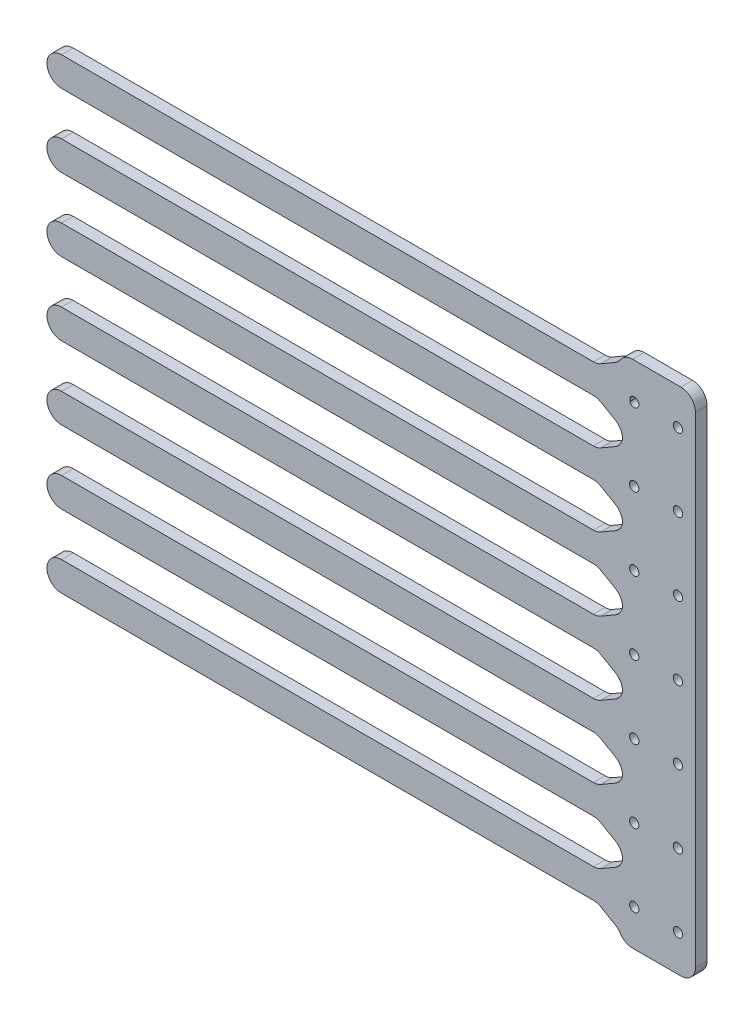
from build123d import *
from OCP.BRepFilletAPI import BRepFilletAPI_MakeChamfer

# Parameters (mm, degrees)
SKETCH_1_W                  = 25
SKETCH_1_H                  = 175
EXTRUDE_1_DEPTH             = 4
SKETCH_3_R                  = 1.6
CUT_EXTRUDE_1_DEPTH         = 89.478811023
SKETCH_4_W                  = 200
SKETCH_4_H                  = 10
EXTRUDE_2_DEPTH             = 4
CHAMFER_1_SIZE              = 5
CHAMFER_1_SIZE2             = 8.660254038
FILLET_1_R                  = 5
PATTERN_LINEAR_2_DEPTH      = 4
FILLET_2_R                  = 5
PATTERN_LINEAR_3_COUNT      = 2
PATTERN_LINEAR_3_PITCH      = 15
PATTERN_LINEAR_3_COUNT_DIR2 = 7
PATTERN_LINEAR_3_PITCH_DIR2 = 25


# Read off the part's stored shape, not the designer's step: 阵列(线性)2
with BuildPart() as part:
    # 草图1 → 凸台-拉伸1 (new body)
    with BuildSketch(Plane.XY):
        Rectangle(SKETCH_1_W, SKETCH_1_H)
    extrude(amount=EXTRUDE_1_DEPTH)

    # 草图3 → 切除-拉伸1 (cut, through all)
    with BuildSketch(Plane.XY):
        with Locations((-8.5, 75)):
            Circle(SKETCH_3_R)
    cut_extrude_1 = extrude(amount=CUT_EXTRUDE_1_DEPTH, mode=Mode.SUBTRACT)

    # 草图4 → 凸台-拉伸2 (add)
    with BuildSketch(Plane.XY):
        with Locations((-110, 75)):
            Rectangle(SKETCH_4_W, SKETCH_4_H)
    extrude(amount=EXTRUDE_2_DEPTH)

    # 倒角1: one chamfer whose edges measure the first distance from different faces: ONE call of the kernel's chamfer builder (chamfer() names one face for all edges)
    chamfer_1_edges_1 = [part.edges().sort_by_distance(p)[0] for p in [
        (-12.5, 80, 2),
    ]]
    chamfer_1_side_1 = [part.faces().sort_by_distance(p)[0] for p in [
        (-12.5, 83.75, 2),
    ]]
    chamfer_1_edges_2 = [part.edges().sort_by_distance(p)[0] for p in [
        (-12.5, 70, 2),
    ]]
    chamfer_1_side_2 = [part.faces().sort_by_distance(p)[0] for p in [
        (-12.5, -8.75, 2),
    ]]
    chamfer_1 = BRepFilletAPI_MakeChamfer(part.part.solid().wrapped)
    for e in chamfer_1_edges_1:
        chamfer_1.Add(CHAMFER_1_SIZE, CHAMFER_1_SIZE2, e.wrapped, chamfer_1_side_1[0].wrapped)  # the first distance lies on this face
    for e in chamfer_1_edges_2:
        chamfer_1.Add(CHAMFER_1_SIZE, CHAMFER_1_SIZE2, e.wrapped, chamfer_1_side_2[0].wrapped)  # the first distance lies on this face
    add(Compound.cast(chamfer_1.Shape()), mode=Mode.REPLACE)

    # 圆角1
    # the kernel refuses this fillet: 5 mm, written as the material it adds along each edge
    with BuildSketch(Plane(origin=(-21.160254038, 70, 0), x_dir=(-1, 0, 0), z_dir=(0, 0, 1))) as fillet_1_piece_1:
        with BuildLine():
            CenterArc((FILLET_1_R * 0.267949192431, FILLET_1_R), FILLET_1_R, 240, 30)
            Line((-FILLET_1_R * 0.232050807569, FILLET_1_R * 0.133974596216), (0, 0))
            Line((0, 0), (FILLET_1_R * 0.267949192431, 0))
        make_face()
    extrude(amount=4)
    with BuildSketch(Plane(origin=(-12.5, 65, 0), x_dir=(0, -1, 0), z_dir=(0, 0, 1))) as fillet_1_piece_2:
        with BuildLine():
            CenterArc((FILLET_1_R * 0.57735026919, -FILLET_1_R), FILLET_1_R, 90, 60)
            Line((-FILLET_1_R * 0.288675134595, -FILLET_1_R * 0.5), (0, 0))
            Line((0, 0), (FILLET_1_R * 0.57735026919, 0))
        make_face()
    extrude(amount=4)
    with BuildSketch(Plane(origin=(-21.160254038, 80, 4), x_dir=(0.8660254037844394, 0.4999999999999988, 0), z_dir=(0, 0, -1))) as fillet_1_piece_3:
        with BuildLine():
            CenterArc((FILLET_1_R * 0.267949192431, -FILLET_1_R), FILLET_1_R, 90, 30)
            Line((-FILLET_1_R * 0.232050807569, -FILLET_1_R * 0.133974596216), (0, 0))
            Line((0, 0), (FILLET_1_R * 0.267949192431, 0))
        make_face()
    extrude(amount=4)
    with BuildSketch(Plane(origin=(-12.5, 85, 4), x_dir=(-2.0790480448337104e-12, 1.0, 0), z_dir=(0, 0, -1))) as fillet_1_piece_4:
        with BuildLine():
            CenterArc((2.895810682, -4.984308769), FILLET_1_R, 94.540406951, 55.459593049)
            Line((-1.434316336, -2.484308769), (0, 0))
            Line((0, 0), (2.5, 0))
        make_face()
    extrude(amount=4)
    # the kernel refuses this fillet: 5 mm, written as the material it takes off along each edge
    with BuildSketch(Plane(origin=(-210, 70, -12.5), x_dir=(0, 1, 0), z_dir=(0, 0, 1)), Plane(origin=(-210, 80, -12.5), x_dir=(1, 0, 0), z_dir=(0, 0, 1))) as fillet_1_2_piece_1:
        with BuildLine():
            CenterArc((FILLET_1_R, -FILLET_1_R), FILLET_1_R, 90, 90)
            Line((0, -FILLET_1_R), (0, 0))
            Line((0, 0), (FILLET_1_R, 0))
        make_face()
    extrude(amount=29, mode=Mode.SUBTRACT)

    # 阵列(线性)2 outline → 阵列(线性)2 (add)
    with BuildSketch(Plane.XY):
        with BuildLine():
            Line((-12.5, -87.5), (-12.5, -62.886751346))
            ThreePointArc((-12.5, -62.886751346), (-13.321545605, -64.919332951), (-14.933656987, -66.405072517))
            Line((-14.933656987, -66.405072517), (-20, -69.330127019))
            ThreePointArc((-20, -69.330127019), (-21.205904775, -69.829629131), (-22.5, -70))
            Line((-22.5, -70), (-205, -70))
            ThreePointArc((-205, -70), (-208.535533906, -71.464466094), (-210, -75))
            ThreePointArc((-210, -75), (-208.535533906, -78.535533906), (-205, -80))
            Line((-205, -80), (-22.5, -80))
            ThreePointArc((-22.5, -80), (-21.205904775, -80.170370869), (-20, -80.669872981))
            Line((-20, -80.669872981), (-14.984308769, -83.565683664))
            ThreePointArc((-14.984308769, -83.565683664), (-13.256610731, -85.226247178), (-12.5, -87.5))
        make_face()
        with BuildLine():
            Line((-12.5, -62.886751346), (-12.5, -37.886751346))
            ThreePointArc((-12.5, -37.886751346), (-13.321545605, -39.919332951), (-14.933656987, -41.405072517))
            Line((-14.933656987, -41.405072517), (-20, -44.330127019))
            ThreePointArc((-20, -44.330127019), (-21.205904775, -44.829629131), (-22.5, -45))
            Line((-22.5, -45), (-205, -45))
            ThreePointArc((-205, -45), (-208.535533906, -46.464466094), (-210, -50))
            ThreePointArc((-210, -50), (-208.535533906, -53.535533906), (-205, -55))
            Line((-205, -55), (-22.5, -55))
            ThreePointArc((-22.5, -55), (-21.205904775, -55.170370869), (-20, -55.669872981))
            Line((-20, -55.669872981), (-15, -58.556624327))
            ThreePointArc((-15, -58.556624327), (-13.169872981, -60.386751346), (-12.5, -62.886751346))
        make_face()
        with BuildLine():
            Line((-12.5, -37.886751346), (-12.5, -12.886751346))
            ThreePointArc((-12.5, -12.886751346), (-13.321545605, -14.919332951), (-14.933656987, -16.405072517))
            Line((-14.933656987, -16.405072517), (-20, -19.330127019))
            ThreePointArc((-20, -19.330127019), (-21.205904775, -19.829629131), (-22.5, -20))
            Line((-22.5, -20), (-205, -20))
            ThreePointArc((-205, -20), (-208.535533906, -21.464466094), (-210, -25))
            ThreePointArc((-210, -25), (-208.535533906, -28.535533906), (-205, -30))
            Line((-205, -30), (-22.5, -30))
            ThreePointArc((-22.5, -30), (-21.205904775, -30.170370869), (-20, -30.669872981))
            Line((-20, -30.669872981), (-15, -33.556624327))
            ThreePointArc((-15, -33.556624327), (-13.169872981, -35.386751346), (-12.5, -37.886751346))
        make_face()
        with BuildLine():
            Line((-12.5, -12.886751346), (-12.5, 12.113248654))
            ThreePointArc((-12.5, 12.113248654), (-13.321545605, 10.080667049), (-14.933656987, 8.594927483))
            Line((-14.933656987, 8.594927483), (-20, 5.669872981))
            ThreePointArc((-20, 5.669872981), (-21.205904775, 5.170370869), (-22.5, 5))
            Line((-22.5, 5), (-205, 5))
            ThreePointArc((-205, 5), (-208.535533906, 3.535533906), (-210, 0))
            ThreePointArc((-210, 0), (-208.535533906, -3.535533906), (-205, -5))
            Line((-205, -5), (-22.5, -5))
            ThreePointArc((-22.5, -5), (-21.205904775, -5.170370869), (-20, -5.669872981))
            Line((-20, -5.669872981), (-15, -8.556624327))
            ThreePointArc((-15, -8.556624327), (-13.169872981, -10.386751346), (-12.5, -12.886751346))
        make_face()
        with BuildLine():
            Line((-12.5, 12.113248654), (-12.5, 37.113248654))
            ThreePointArc((-12.5, 37.113248654), (-13.321545605, 35.080667049), (-14.933656987, 33.594927483))
            Line((-14.933656987, 33.594927483), (-20, 30.669872981))
            ThreePointArc((-20, 30.669872981), (-21.205904775, 30.170370869), (-22.5, 30))
            Line((-22.5, 30), (-205, 30))
            ThreePointArc((-205, 30), (-208.535533906, 28.535533906), (-210, 25))
            ThreePointArc((-210, 25), (-208.535533906, 21.464466094), (-205, 20))
            Line((-205, 20), (-22.5, 20))
            ThreePointArc((-22.5, 20), (-21.205904775, 19.829629131), (-20, 19.330127019))
            Line((-20, 19.330127019), (-15, 16.443375673))
            ThreePointArc((-15, 16.443375673), (-13.169872981, 14.613248654), (-12.5, 12.113248654))
        make_face()
        with BuildLine():
            Line((-22.5, 55), (-205, 55))
            ThreePointArc((-205, 55), (-208.535533906, 53.535533906), (-210, 50))
            ThreePointArc((-210, 50), (-208.535533906, 46.464466094), (-205, 45))
            Line((-205, 45), (-22.5, 45))
            ThreePointArc((-22.5, 45), (-21.205904775, 44.829629131), (-20, 44.330127019))
            Line((-20, 44.330127019), (-15, 41.443375673))
            ThreePointArc((-15, 41.443375673), (-13.169872981, 39.613248654), (-12.5, 37.113248654))
            Line((-12.5, 37.113248654), (-12.5, 62.113248654))
            ThreePointArc((-12.5, 62.113248654), (-13.321545605, 60.080667049), (-14.933656987, 58.594927483))
            Line((-14.933656987, 58.594927483), (-20, 55.669872981))
            ThreePointArc((-20, 55.669872981), (-21.205904775, 55.170370869), (-22.5, 55))
        make_face()
    extrude(amount=PATTERN_LINEAR_2_DEPTH)

    # 圆角2
    fillet_2_edges = [part.edges().sort_by_distance(p)[0] for p in [
        (-12.5, 87.5, 2),
        (12.5, 87.5, 2),
        (12.5, -87.5, 2),
        (-12.5, -87.5, 2),
    ]]
    fillet(fillet_2_edges, radius=FILLET_2_R)

    # 阵列(线性)3: Cut-Extrude 1 2 × 7
    with Locations(*[(i * PATTERN_LINEAR_3_PITCH, -j * PATTERN_LINEAR_3_PITCH_DIR2, 0) for i in range(PATTERN_LINEAR_3_COUNT) for j in range(PATTERN_LINEAR_3_COUNT_DIR2) if (i, j) != (0, 0)]):
        add(cut_extrude_1, mode=Mode.SUBTRACT)


solid = part.part
